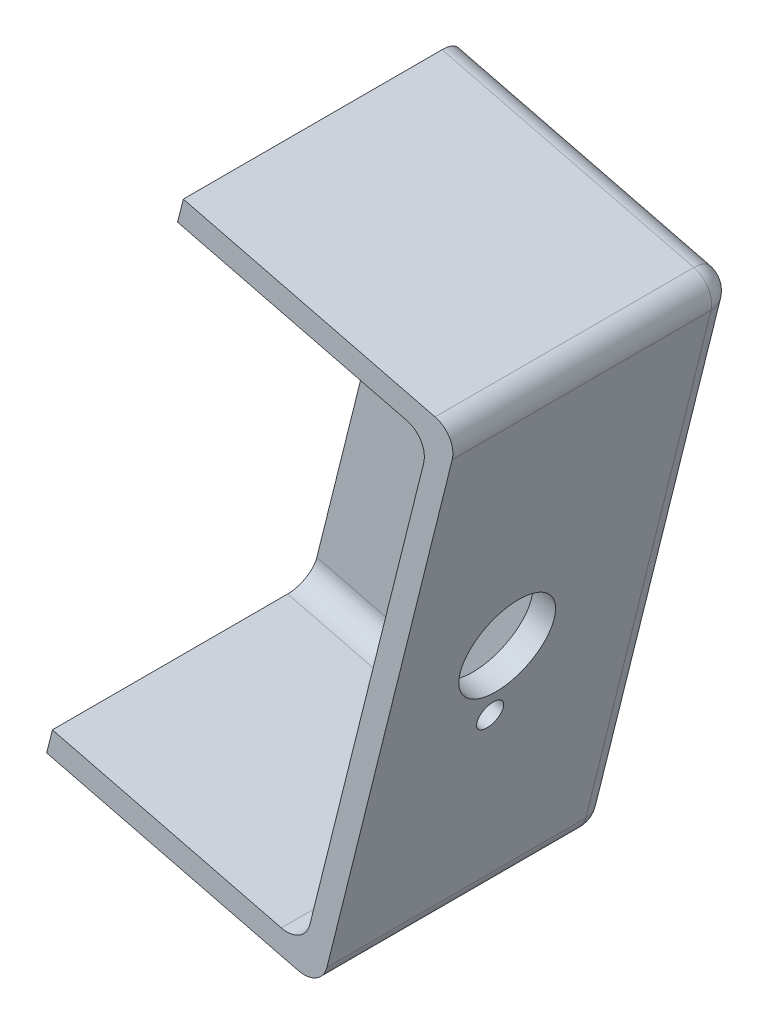
from build123d import *

# Parameters (mm, degrees)
EXTRUDE_THIN1_DEPTH             = 38.1
BOSS_EXTRUDE1_DEPTH             = 3.175
F_8_CLEARANCE_HOLE1_D           = 4.9149
FILLET1_R                       = 3.175
F_1_2_0_5_DIAMETER_HOLE1_D      = 12.7
F_9_64_0_14063_DIAMETER_HOLE1_D = 3.572002


with BuildPart() as part:
    # Sketch1 → Extrude-Thin1 (new body)
    with BuildSketch(Plane.XY):
        Polygon((-450.568590055, 3232.318777264), (-413.513639003, 3223.079940323), (-431.947583815, 3149.145425944), (-469.0030385, 3158.382242922), (-468.235104419, 3161.462973719), (-434.260212597, 3152.994048962), (-417.362429953, 3220.76735341), (-451.336692074, 3229.238088333), align=None)
    extrude(amount=-EXTRUDE_THIN1_DEPTH)

    # Sketch2 → Boss-Extrude1 (add)
    with BuildSketch(Plane(origin=(0, 0, -38.1), x_dir=(-1, 0, 0), z_dir=(0, 0, -1))):
        Polygon((413.513639003, 3223.079940323), (431.947583815, 3149.145425944), (469.0030385, 3158.382242922), (450.568590055, 3232.318777264), align=None)
    extrude(amount=-BOSS_EXTRUDE1_DEPTH)

    # #8 Clearance Hole1 (through all)
    with Locations(Plane.XY.offset(-34.925)):
        with Locations((-439.773757512, 3209.994133586), (-448.990981734, 3173.025866414)):
            Hole(F_8_CLEARANCE_HOLE1_D / 2)

    # Fillet1
    fillet1_edges = [part.edges().sort_by_distance(p)[0] for p in [
        (-413.513639003, 3223.079940323, -19.05),
        (-417.362429953, 3220.76735341, -17.4625),
        (-434.349561013, 3225.002720872, -34.925),
        (-451.247574539, 3157.228490409, -34.925),
        (-434.260212597, 3152.994048962, -17.4625),
        (-450.475311157, 3153.763834433, -38.1),
        (-431.947583815, 3149.145425944, -19.05),
        (-432.041114529, 3227.699358793, -38.1),
        (-422.730611409, 3186.112683133, -38.1),
    ]]
    fillet(fillet1_edges, radius=FILLET1_R - 0.0001)  # a hair under: the kernel refuses the full size

    # 1/2 (0.5) Diameter Hole1 (through all)
    with Locations(Plane(origin=(-1145.884443872, 285.70107988, 0), x_dir=(0, 0, -1), z_dir=(0.9702957262759976, -0.24192189559966307, 0))):
        with Locations((15.875, 2989.202688137)):
            Hole(F_1_2_0_5_DIAMETER_HOLE1_D / 2)

    # 9/64 (0.14063) Diameter Hole1 (through all)
    with Locations(Plane(origin=(-1145.884443872, 285.70107988, 0), x_dir=(0, 0, -1), z_dir=(0.9702957262759976, -0.24192189559966307, 0))):
        with Locations((15.875, 2979.677688137)):
            Hole(F_9_64_0_14063_DIAMETER_HOLE1_D / 2)


solid = part.part
